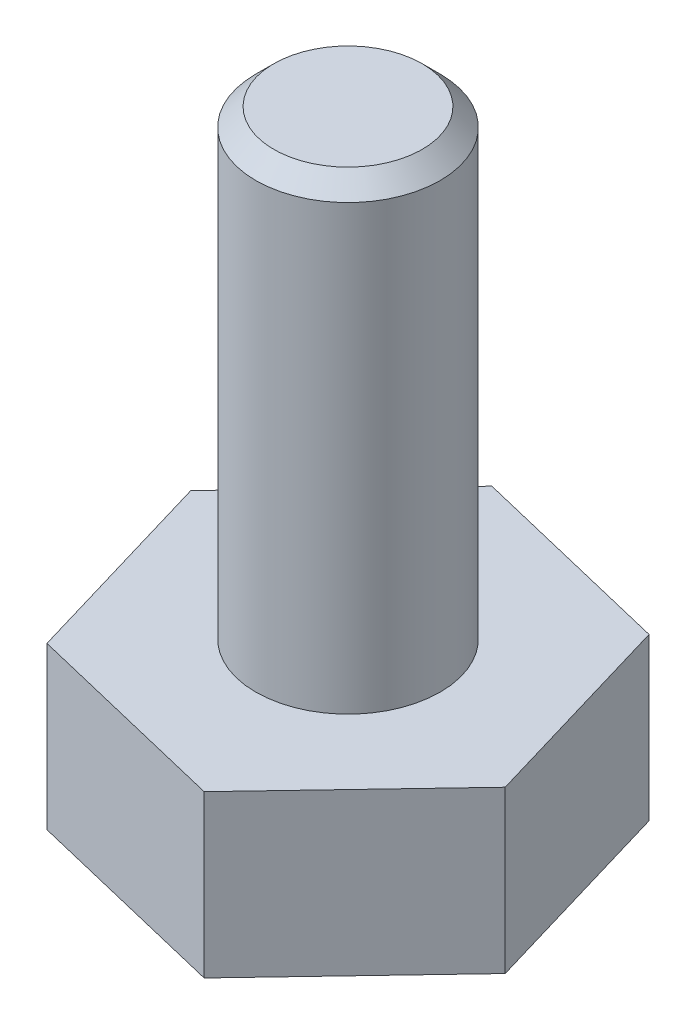
from build123d import *

# Parameters (mm, degrees)
EXTRUDE_1_DEPTH = 3.5
SKETCH_2_R      = 2.5
EXTRUDE_2_DEPTH = 10


# Read off the part's stored shape, not the designer's step: M4x0.7 Машинная резьба Шпилька1
with BuildPart() as part:
    # Эскиз1 → Бобышка-Вытянуть1 (new body)
    with BuildSketch(Plane(origin=(0, 0, 0), x_dir=(1, 0, 0), z_dir=(0, 1, 0))):
        Polygon((1.309524818, -4.42927512), (4.490627183, -1.080555801), (3.181102365, 3.348719319), (-1.309524818, 4.42927512), (-4.490627183, 1.080555801), (-3.181102365, -3.348719319), align=None)
    extrude(amount=EXTRUDE_1_DEPTH)

    # Эскиз2 → Бобышка-Вытянуть2 (add)
    with BuildSketch(Plane(origin=(0, 3.5, 0), x_dir=(1, 0, 0), z_dir=(0, 1, 0))):
        with Locations(Location((0, 0, 0), (0, 0, 270))):
            Circle(SKETCH_2_R)
    extrude(amount=EXTRUDE_2_DEPTH)

    # M4x0.7 Машинная резьба Шпилька1 outline → M4x0.7 Машинная резьба Шпилька1 (revolve, cut)
    with BuildSketch(Plane.XY):
        Polygon((2, 13.11), (2, 3.5), (2.5, 3.5), (2.5, 13.5), (1.61, 13.5), align=None)
    revolve(axis=Axis((0, 0, 0), (0, 1, 0)), mode=Mode.SUBTRACT)


solid = part.part
